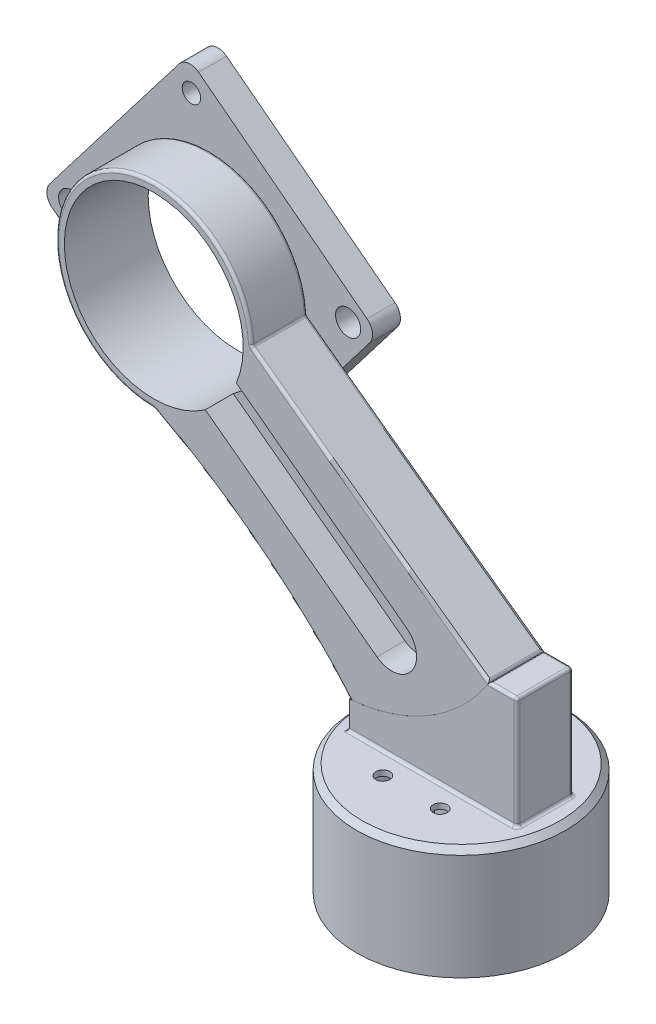
from build123d import *

# Parameters (mm, degrees)
SKETCH1_R               = 18.73
BOSS_EXTRUDE1_DEPTH     = 20
CHAMFER1_SIZE           = 1
SKETCH2_W               = 30
SKETCH2_H               = 10
BOSS_EXTRUDE2_DEPTH     = 20
CUT_EXTRUDE1_DEPTH      = 51.13906461
CUT_EXTRUDE1_DEPTH_BACK = 51.13906461
BOSS_EXTRUDE3_DEPTH     = 5
FILLET1_R               = 0.5
FILLET2_R               = 0.5
FILLET3_R               = 0.5
CUT_EXTRUDE2_DEPTH      = 114.029256969
CUT_EXTRUDE2_DEPTH_BACK = 114.029256969
SKETCH8_R               = 16
SKETCH9_R               = 16
BOSS_EXTRUDE6_DEPTH     = 5
SKETCH11_R              = 1.65
SKETCH11_R_2            = 2.25
CUT_EXTRUDE4_DEPTH      = 5
CUT_EXTRUDE5_DEPTH      = 5
SKETCH13_R              = 1.25
CUT_EXTRUDE6_DEPTH      = 130.627647397
SKETCH15_R              = 16.73
CUT_EXTRUDE8_DEPTH      = 19
BOSS_EXTRUDE7_REACH     = 131.628
BOSS_EXTRUDE8_DEPTH     = 8
FILLET4_R               = 2.5


with BuildPart() as part:
    # Sketch1 → Boss-Extrude1 (new body)
    with BuildSketch(Plane(origin=(0, 0, 0), x_dir=(1, 0, 0), z_dir=(0, 1, 0))):
        with Locations(Location((0, 0, 0), (0, 0, 270))):
            Circle(SKETCH1_R)
    extrude(amount=BOSS_EXTRUDE1_DEPTH)

    # Chamfer1
    chamfer1_edges = [part.edges().sort_by_distance(p)[0] for p in [
        (0, 20, -18.73),
    ]]
    chamfer(chamfer1_edges, length=CHAMFER1_SIZE)

    # Sketch2 → Boss-Extrude2 (add)
    with BuildSketch(Plane(origin=(0, 20, 0), x_dir=(1, 0, 0), z_dir=(0, 1, 0))):
        Rectangle(SKETCH2_W, SKETCH2_H)
    extrude(amount=BOSS_EXTRUDE2_DEPTH)

    # Sketch3 → Cut-Extrude1 (cut, two sides: drawn at the far end of the back side and taken through both)
    with BuildSketch(Plane.XY.offset(5).offset(-CUT_EXTRUDE1_DEPTH_BACK)):
        with BuildLine():
            Line((-15, 40), (10, 40))
            ThreePointArc((10, 40), (-0.735614041, 29.559356734), (-15, 25))
            Line((-15, 25), (-15, 40))
        make_face()
    extrude(amount=CUT_EXTRUDE1_DEPTH + CUT_EXTRUDE1_DEPTH_BACK, mode=Mode.SUBTRACT)

    # Fillet1
    fillet1_edges = [part.edges().sort_by_distance(p)[0] for p in [
        (15, 20, 0),
        (15, 30, 5),
        (0, 20, -5),
        (15, 30, -5),
        (-15, 20, 0),
        (0, 20, 5),
        (15, 40, 0),
    ]]
    fillet(fillet1_edges, radius=FILLET1_R)

    # Fillet2
    # the kernel refuses this fillet: 0.5 mm, written as the material it takes off along each edge
    with BuildSketch(Plane(origin=(14.5, 39.5, -4.5), x_dir=(0, 1, 0), z_dir=(0, 0, -1))) as fillet2_piece_1_section:
        Polygon((0, 0), (FILLET2_R, 0), (FILLET2_R, FILLET2_R), (0, FILLET2_R), align=None)
    fillet2_piece_1 = extrude(amount=FILLET2_R, mode=Mode.PRIVATE)
    fillet2_piece_1 = fillet2_piece_1 - Plane(origin=(14.5, 39.5, -4.5), x_dir=(-0.7071067811865475, -0.7071067811865475, 0), z_dir=(0, 0, -1)) * Sphere(FILLET2_R, mode=Mode.PRIVATE)
    add(fillet2_piece_1, mode=Mode.SUBTRACT)
    with BuildSketch(Plane(origin=(14.5, 39.5, 4.5), x_dir=(0, 1, 0), z_dir=(0, 0, 1))) as fillet2_piece_2_section:
        Polygon((0, 0), (FILLET2_R, 0), (FILLET2_R, -FILLET2_R), (0, -FILLET2_R), align=None)
    fillet2_piece_2 = extrude(amount=FILLET2_R, mode=Mode.PRIVATE)
    fillet2_piece_2 = fillet2_piece_2 - Plane(origin=(14.5, 39.5, 4.5), x_dir=(-0.7071067811865475, -0.7071067811865475, 0), z_dir=(0, 0, 1)) * Sphere(FILLET2_R, mode=Mode.PRIVATE)
    add(fillet2_piece_2, mode=Mode.SUBTRACT)
    with BuildSketch(Plane(origin=(8.75, 40, 5), x_dir=(0, -1, 0), z_dir=(1, 0, 0)), Plane(origin=(14.5, 40, -5), x_dir=(0, -1, 0), z_dir=(-1, 0, 0))) as fillet2_piece_3:
        with BuildLine():
            CenterArc((FILLET2_R, FILLET2_R), FILLET2_R, 180, 90)
            Line((0, FILLET2_R), (0, 0))
            Line((0, 0), (FILLET2_R, 0))
        make_face()
    extrude(amount=5.75, mode=Mode.SUBTRACT)
    with BuildSketch(Plane(origin=(10, 40, -5.681553415), x_dir=(1, 0, 0), z_dir=(0, 0, 1))) as fillet2_piece_4:
        with BuildLine():
            CenterArc((0.272621366, -0.5), FILLET2_R, 90, 56.96605651)
            ThreePointArc((-0.146552515, -0.227432105), (-0.073041014, -0.113867639), (0, 0))
            Line((0, 0), (0.272621366, 0))
        make_face()
    extrude(amount=11.36310683, mode=Mode.SUBTRACT)

    # Sketch13 → Cut-Extrude6 (cut, through all)
    with BuildSketch(Plane.XZ):
        with Locations(Location((-5.13, 8.88, 0), (0, 0, 270))):
            Circle(SKETCH13_R)
        with Locations(Location((5.125305586, 8.882710321, 0), (0, 0, 270))):
            Circle(SKETCH13_R)
        with Locations(Location((5.13, -8.88, 0), (0, 0, 270))):
            Circle(SKETCH13_R)
        with Locations(Location((-5.125305586, -8.882710321, 0), (0, 0, 270))):
            Circle(SKETCH13_R)
    extrude(amount=-CUT_EXTRUDE6_DEPTH, mode=Mode.SUBTRACT)

    # Sketch15 → Cut-Extrude8 (cut)
    with BuildSketch(Plane.XZ):
        with Locations(Location((0, 0, 0), (0, 0, 270))):
            Circle(SKETCH15_R)
    extrude(amount=-CUT_EXTRUDE8_DEPTH, mode=Mode.SUBTRACT)

    # Sketch15<5> → Boss-Extrude7 (add, up to next)
    with BuildSketch(Plane.XZ, mode=Mode.PRIVATE) as boss_extrude7_sk1:
        Polygon((-1.73, 3), (1.73, 3), (3.46, 0), (1.73, -3), (-1.73, -3), (-3.46, 0), align=None)
    boss_extrude7_tool1 = extrude(boss_extrude7_sk1.sketch, amount=-BOSS_EXTRUDE7_REACH, mode=Mode.PRIVATE) - part.part
    add(boss_extrude7_tool1.solids().sort_by_distance((0, 0, 0))[0])

    # Sketch15<7> → Boss-Extrude8 (add)
    with BuildSketch(Plane.XZ):
        Polygon((-1.73, 3), (1.73, 3), (3.46, 0), (1.73, -3), (-1.73, -3), (-3.46, 0), align=None)
    extrude(amount=BOSS_EXTRUDE8_DEPTH)


with BuildPart() as body_2:
    # Sketch4 → Boss-Extrude3 (new, symmetric)
    with BuildSketch(Plane.XY):
        with BuildLine():
            ThreePointArc((-32.518781125, 70.810547124), (-62.657696763, 82.084399558), (-50, 52.5))
            ThreePointArc((-50, 52.5), (-31.266083512, 40.320439167), (-15, 25))
            ThreePointArc((-15, 25), (-0.735614041, 29.559356734), (10, 40))
            ThreePointArc((10, 40), (-11.320115155, 55.321473179), (-32.518781125, 70.810547124))
        make_face()
    extrude(amount=BOSS_EXTRUDE3_DEPTH, both=True)

    # Fillet3
    fillet3_edges = [body_2.edges().sort_by_distance(p)[0] for p in [
        (-62.657696763, 82.084399558, -5),
        (-31.266083512, 40.320439167, -5),
        (-31.266083512, 40.320439167, 5),
        (-62.657696763, 82.084399558, 5),
        (-11.320115155, 55.321473179, 5),
        (-15, 25, 0),
        (-50, 52.5, 0),
        (-32.518781125, 70.810547124, 0),
        (10, 40, 0),
        (-11.320115155, 55.321473179, -5),
    ]]
    fillet(fillet3_edges, radius=FILLET3_R)

    # Sketch8 → Cut-Extrude2 (cut, two sides: drawn at the far end of the back side and taken through both)
    with BuildSketch(Plane.XY.offset(5).offset(-CUT_EXTRUDE2_DEPTH_BACK)):
        with Locations((-50, 70)):
            Circle(SKETCH8_R)
    extrude(amount=CUT_EXTRUDE2_DEPTH + CUT_EXTRUDE2_DEPTH_BACK, mode=Mode.SUBTRACT)

    # Sketch9 → Boss-Extrude6 (add)
    with BuildSketch(Plane(origin=(0, 0, -5), x_dir=(-1, 0, 0), z_dir=(0, 0, -1))):
        Polygon((46.03345337, 39.854245609), (80.145754391, 66.03345337), (53.96654663, 100.145754391), (19.854245609, 73.96654663), align=None)
        with Locations(Location((50, 70, 0), (0, 0, 180))):
            Circle(SKETCH9_R, mode=Mode.SUBTRACT)
    extrude(amount=BOSS_EXTRUDE6_DEPTH)

    # Sketch11 → Cut-Extrude4 (cut)
    with BuildSketch(Plane(origin=(0, 0, -10), x_dir=(-1, 0, 0), z_dir=(0, 0, -1))):
        with Locations(Location((53.259947859, 94.775603725, 0), (0, 0, 180))):
            Circle(SKETCH11_R)
        with Locations(Location((46.740052141, 45.224396275, 0), (0, 0, 180))):
            Circle(SKETCH11_R)
        with Locations((74.775603725, 66.740052141)):
            Circle(SKETCH11_R_2)
        with Locations((25.224396275, 73.259947859)):
            Circle(SKETCH11_R_2)
    extrude(amount=-CUT_EXTRUDE4_DEPTH, mode=Mode.SUBTRACT)

    # Sketch12 → Cut-Extrude5 (cut)
    with BuildSketch(Plane.XY.offset(5)):
        with BuildLine():
            Line((-35.929061366, 64.375180992), (-4.75788526, 41.102526938))
            ThreePointArc((-4.75788526, 41.102526938), (-3.857580068, 34.896801029), (-10.063305977, 33.996495837))
            Line((-10.063305977, 33.996495837), (-41.234482084, 57.269149891))
            ThreePointArc((-41.234482084, 57.269149891), (-42.134787275, 63.4748758), (-35.929061366, 64.375180992))
        make_face()
    extrude(amount=-CUT_EXTRUDE5_DEPTH, mode=Mode.SUBTRACT)

    # Fillet4
    fillet4_edges = [body_2.edges().sort_by_distance(p)[0] for p in [
        (-19.854245609, 73.96654663, -7.5),
        (-46.03345337, 39.854245609, -7.5),
        (-80.145754391, 66.03345337, -7.5),
        (-53.96654663, 100.145754391, -7.5),
    ]]
    fillet(fillet4_edges, radius=FILLET4_R)


solid = Compound([part.part, body_2.part])
